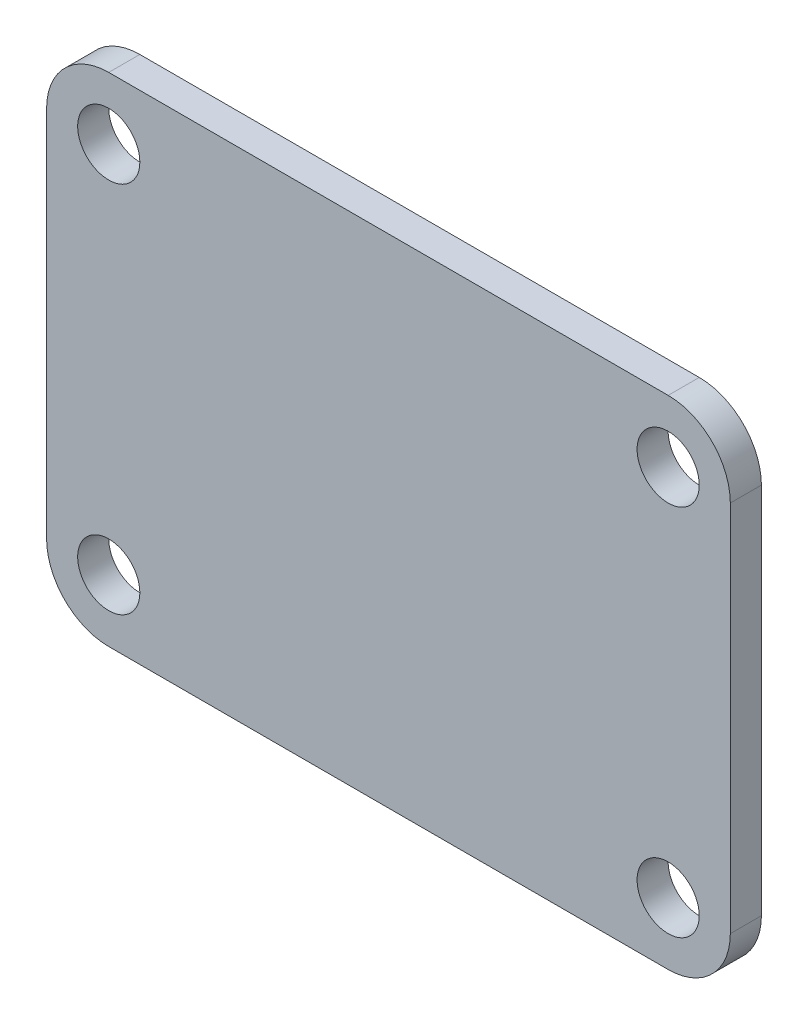
from build123d import *

# Parameters (mm, degrees)
SKETCH1_W           = 27.94
SKETCH1_H           = 20.32
SKETCH1_R           = 1.27
BOSS_EXTRUDE1_DEPTH = 1.27
FILLET1_R           = 2.54


with BuildPart() as part:
    # Sketch1 → Boss-Extrude1 (new body)
    with BuildSketch(Plane.XY):
        with Locations((11.43, 7.62)):
            Rectangle(SKETCH1_W, SKETCH1_H)
        with Locations((0, 15.24)):
            Circle(SKETCH1_R, mode=Mode.SUBTRACT)
        Circle(SKETCH1_R, mode=Mode.SUBTRACT)
        with Locations((22.86, 15.24)):
            Circle(SKETCH1_R, mode=Mode.SUBTRACT)
        with Locations((22.86, 0)):
            Circle(SKETCH1_R, mode=Mode.SUBTRACT)
    extrude(amount=BOSS_EXTRUDE1_DEPTH)

    # Fillet1
    fillet1_edges = [part.edges().sort_by_distance(p)[0] for p in [
        (-2.54, -2.54, 0.635),
        (25.4, -2.54, 0.635),
        (25.4, 17.78, 0.635),
        (-2.54, 17.78, 0.635),
    ]]
    fillet(fillet1_edges, radius=FILLET1_R)


solid = part.part
